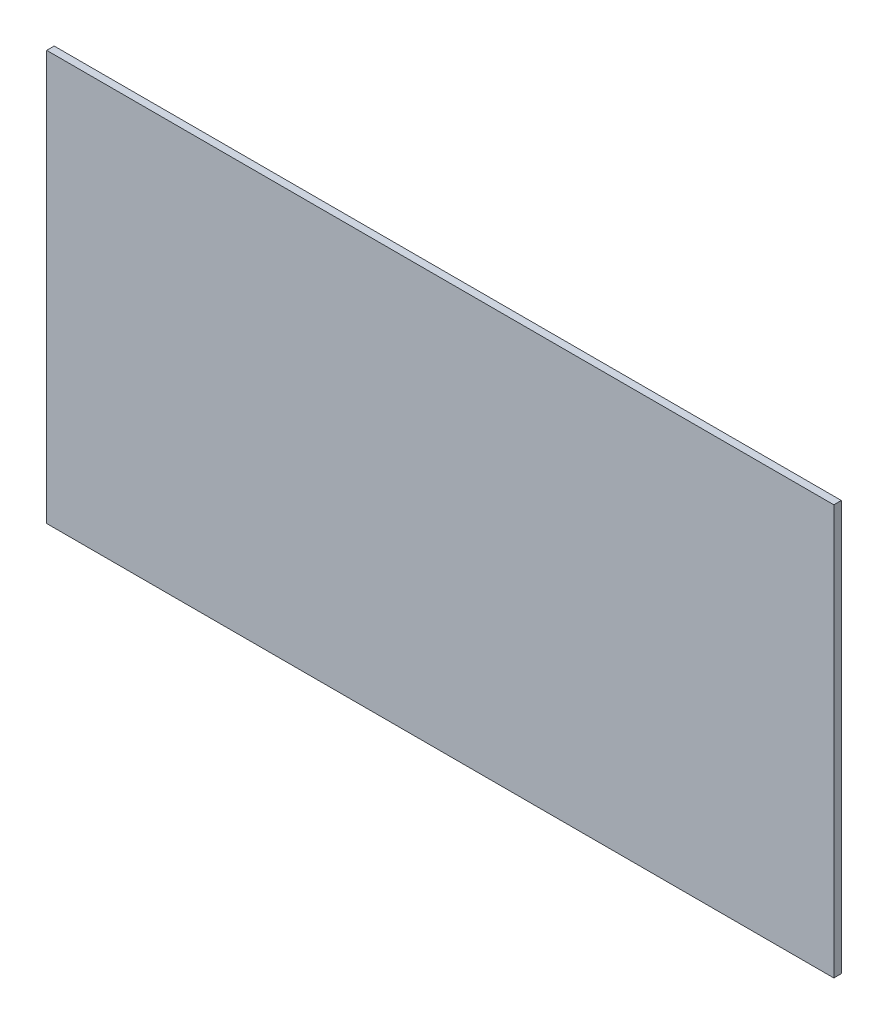
from build123d import *

# Parameters (mm, degrees)
IZIM1_W            = 630
IZIM1_H            = 328
TABAN_FLAN_1_DEPTH = 6


# Sheet-metal steps are written as plain solids
with BuildPart() as part:
    # Çizim1 → Taban-Flanş1 (new body)
    with BuildSketch(Plane.XY):
        with Locations((315, -164)):
            Rectangle(IZIM1_W, IZIM1_H)
    extrude(amount=-TABAN_FLAN_1_DEPTH)


solid = part.part
